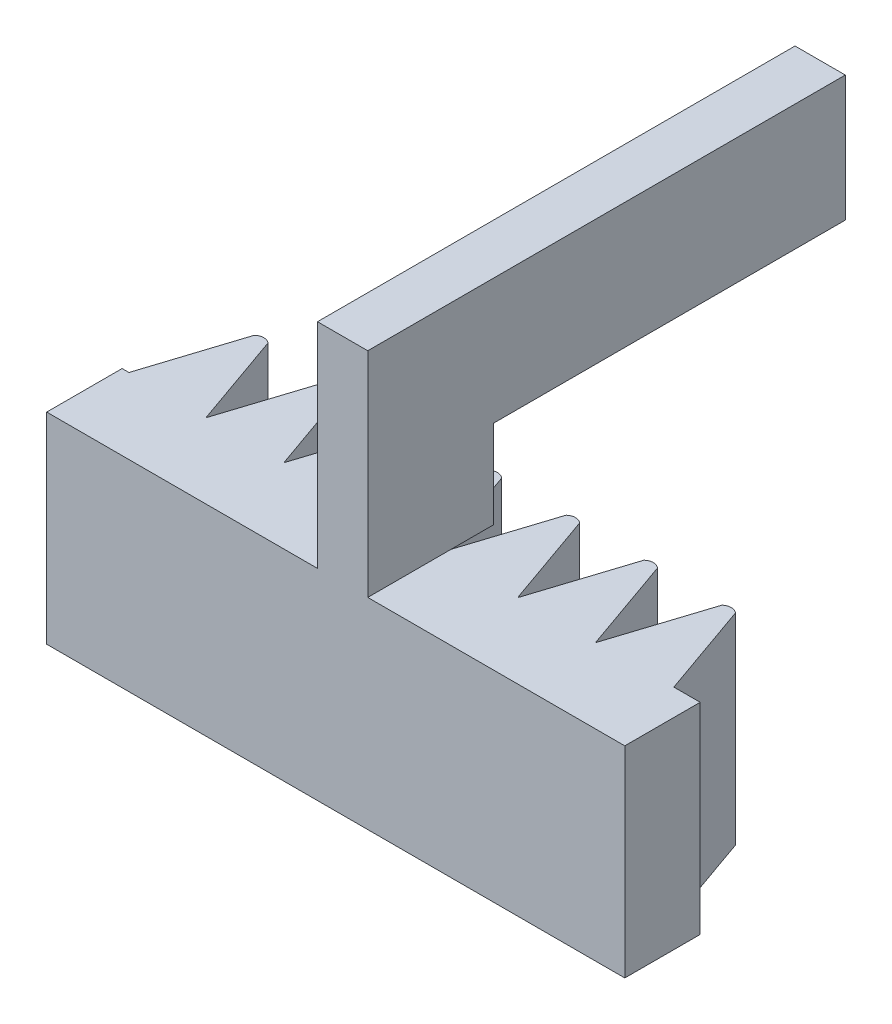
from build123d import *

# Parameters (mm, degrees)
BOSS_EXTRUDE1_DEPTH   = 8
BOSS_EXTRUDE1_2_DEPTH = 8
BOSS_EXTRUDE1_3_DEPTH = 8
BOSS_EXTRUDE1_4_DEPTH = 8
BOSS_EXTRUDE1_5_DEPTH = 8
BOSS_EXTRUDE1_6_DEPTH = 8
BOSS_EXTRUDE1_7_DEPTH = 8
BASE_W                = 23
BASE_H                = 3
BOSS_EXTRUDE2_DEPTH   = 8
SKETCH1_W             = 5
SKETCH1_H             = 8.5
BOSS_EXTRUDE3_DEPTH   = 2
SKETCH2_W             = 2
SKETCH2_H             = 5
BOSS_EXTRUDE4_DEPTH   = 14


with BuildPart() as part:
    # Gears-1 → Boss-Extrude1 (new body)
    with BuildSketch(Plane(origin=(0, 0, 0), x_dir=(1, 0, 0), z_dir=(0, 1, 0))):
        with BuildLine():
            Line((-0.500594601, 0), (0.709644096, 3.775809937))
            ThreePointArc((0.709644096, 3.775809937), (0.980506814, 3.882987586), (1.251369531, 3.775809937))
            Line((1.251369531, 3.775809937), (2.579049224, 0))
            Line((2.579049224, 0), (-0.500594601, 0))
        make_face()
    extrude(amount=BOSS_EXTRUDE1_DEPTH)



with BuildPart() as body_2:
    # Gears-1 → Boss-Extrude1 2 (new body)
    with BuildSketch(Plane(origin=(0, 0, 0), x_dir=(1, 0, 0), z_dir=(0, 1, 0))):
        with BuildLine():
            Line((2.599405399, 0), (5.679049224, 0))
            Line((5.679049224, 0), (4.351369531, 3.775809937))
            ThreePointArc((4.351369531, 3.775809937), (4.080506814, 3.882987586), (3.809644096, 3.775809937))
            Line((3.809644096, 3.775809937), (2.599405399, 0))
        make_face()
    extrude(amount=BOSS_EXTRUDE1_2_DEPTH)


with BuildPart() as body_3:
    # Gears-1 → Boss-Extrude1 3 (new body)
    with BuildSketch(Plane(origin=(0, 0, 0), x_dir=(1, 0, 0), z_dir=(0, 1, 0))):
        with BuildLine():
            Line((5.699405399, 0), (8.779049224, 0))
            Line((8.779049224, 0), (7.451369531, 3.775809937))
            ThreePointArc((7.451369531, 3.775809937), (7.180506814, 3.882987586), (6.909644096, 3.775809937))
            Line((6.909644096, 3.775809937), (5.699405399, 0))
        make_face()
    extrude(amount=BOSS_EXTRUDE1_3_DEPTH)


with BuildPart() as body_4:
    # Gears-1 → Boss-Extrude1 4 (new body)
    with BuildSketch(Plane(origin=(0, 0, 0), x_dir=(1, 0, 0), z_dir=(0, 1, 0))):
        with BuildLine():
            Line((8.799405399, 0), (11.879049224, 0))
            Line((11.879049224, 0), (10.551369531, 3.775809937))
            ThreePointArc((10.551369531, 3.775809937), (10.280506814, 3.882987586), (10.009644096, 3.775809937))
            Line((10.009644096, 3.775809937), (8.799405399, 0))
        make_face()
    extrude(amount=BOSS_EXTRUDE1_4_DEPTH)


with BuildPart() as body_5:
    # Gears-1 → Boss-Extrude1 5 (new body)
    with BuildSketch(Plane(origin=(0, 0, 0), x_dir=(1, 0, 0), z_dir=(0, 1, 0))):
        with BuildLine():
            Line((11.899405399, 0), (14.979049224, 0))
            Line((14.979049224, 0), (13.651369531, 3.775809937))
            ThreePointArc((13.651369531, 3.775809937), (13.380506814, 3.882987586), (13.109644096, 3.775809937))
            Line((13.109644096, 3.775809937), (11.899405399, 0))
        make_face()
    extrude(amount=BOSS_EXTRUDE1_5_DEPTH)


with BuildPart() as body_6:
    # Gears-1 → Boss-Extrude1 6 (new body)
    with BuildSketch(Plane(origin=(0, 0, 0), x_dir=(1, 0, 0), z_dir=(0, 1, 0))):
        with BuildLine():
            Line((14.999405399, 0), (18.079049224, 0))
            Line((18.079049224, 0), (16.751369531, 3.775809937))
            ThreePointArc((16.751369531, 3.775809937), (16.480506814, 3.882987586), (16.209644096, 3.775809937))
            Line((16.209644096, 3.775809937), (14.999405399, 0))
        make_face()
    extrude(amount=BOSS_EXTRUDE1_6_DEPTH)


with BuildPart() as body_7:
    # Gears-1 → Boss-Extrude1 7 (new body)
    with BuildSketch(Plane(origin=(0, 0, 0), x_dir=(1, 0, 0), z_dir=(0, 1, 0))):
        with BuildLine():
            Line((18.099405399, 0), (21.179049224, 0))
            Line((21.179049224, 0), (19.851369531, 3.775809937))
            ThreePointArc((19.851369531, 3.775809937), (19.580506814, 3.882987586), (19.309644096, 3.775809937))
            Line((19.309644096, 3.775809937), (18.099405399, 0))
        make_face()
    extrude(amount=BOSS_EXTRUDE1_7_DEPTH)


with BuildPart() as part_1:
    add(part.part)

    add(body_2.part)  # Boss-Extrude2 merges body 2

    add(body_3.part)  # Boss-Extrude2 merges body 3

    add(body_4.part)  # Boss-Extrude2 merges body 4

    add(body_5.part)  # Boss-Extrude2 merges body 5

    add(body_6.part)  # Boss-Extrude2 merges body 6

    add(body_7.part)  # Boss-Extrude2 merges body 7
    # Base → Boss-Extrude2 (add)
    with BuildSketch(Plane(origin=(0, 0, 0), x_dir=(1, 0, 0), z_dir=(0, 1, 0))):
        with Locations((10.726532056, -1.5)):
            Rectangle(BASE_W, BASE_H)
    extrude(amount=BOSS_EXTRUDE2_DEPTH)

    # Sketch1 → Boss-Extrude3 (add)
    with BuildSketch(Plane(origin=(10, 0, 0), x_dir=(0, 0, -1), z_dir=(1, 0, 0))):
        with Locations((-0.5, 12.25)):
            Rectangle(SKETCH1_W, SKETCH1_H)
    extrude(amount=BOSS_EXTRUDE3_DEPTH)

    # Sketch2 → Boss-Extrude4 (add)
    with BuildSketch(Plane(origin=(0, 0, -2), x_dir=(-1, 0, 0), z_dir=(0, 0, -1))):
        with Locations((-11, 14)):
            Rectangle(SKETCH2_W, SKETCH2_H)
    extrude(amount=BOSS_EXTRUDE4_DEPTH)


solid = part_1.part
